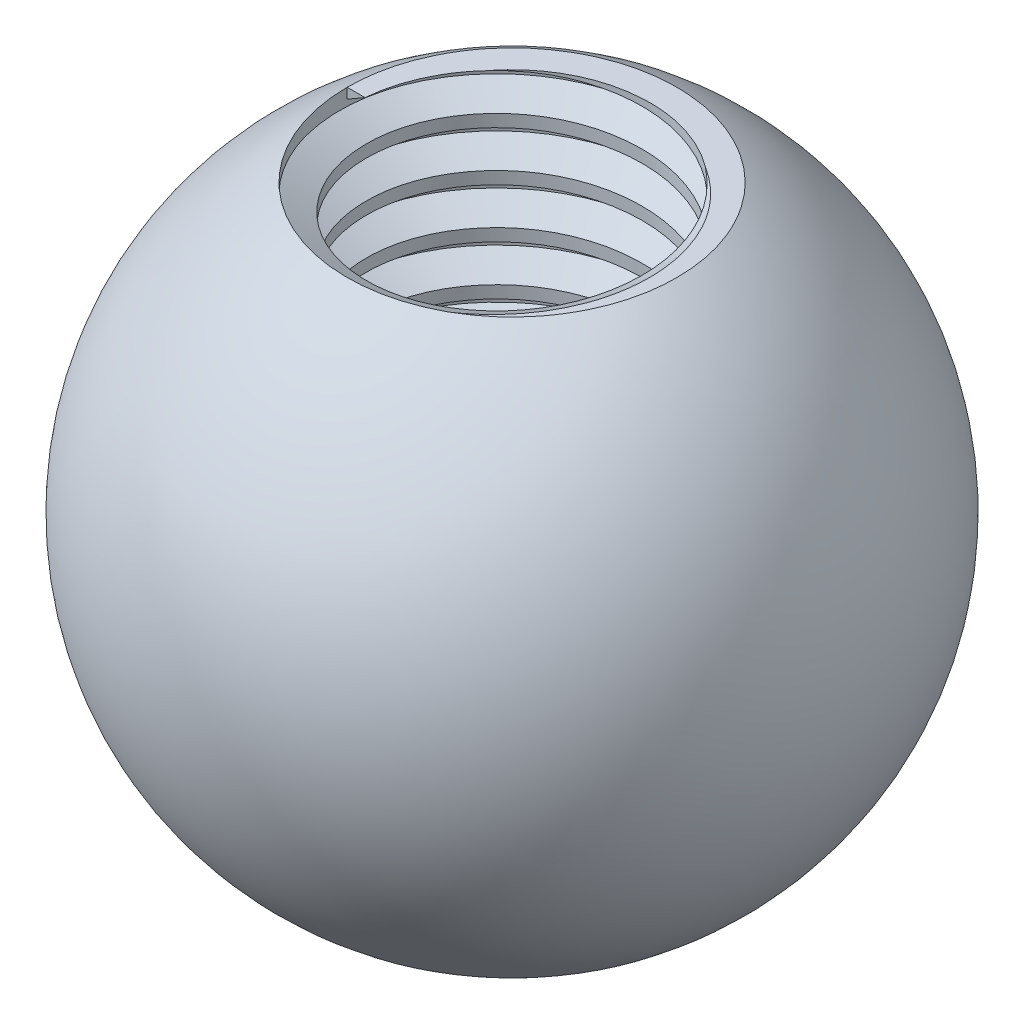
from build123d import *

# Parameters (mm, degrees)
SKETCH3_R              = 5
CUT_EXTRUDE1_DEPTH     = 10
THREAD1_PITCH          = 1.5
CUT_EXTRUDE2_START     = -6
CUT_EXTRUDE2_OUTLINE_W = 14
CUT_EXTRUDE2_OUTLINE_H = 2.339745962
CUT_EXTRUDE2_DEPTH     = 11.0000001


with BuildPart() as part:
    # Sketch2 → Revolve1 (revolve)
    with BuildSketch(Plane.XY):
        with BuildLine():
            Line((0, 10), (0, -10))
            ThreePointArc((0, -10), (10, 0), (0, 10))
        make_face()
    revolve(axis=Axis((0, 10, 0), (0, -1, 0)))

    # Sketch3 → Cut-Extrude1 (cut)
    with BuildSketch(Plane(origin=(0, 0, 0), x_dir=(1, 0, 0), z_dir=(0, 1, 0))):
        with Locations(Location((0, 0, 0), (0, 0, 90))):
            Circle(SKETCH3_R)
    extrude(amount=CUT_EXTRUDE1_DEPTH, mode=Mode.SUBTRACT)

    # Thread1: arcs per turn and ends read off the stored shape
    # Thread1: the profile of Thread Profile1 profile screwed along a right-hand helix through 7.333333 turns, 8 arcs to a turn; built about Z, then put on its axis
    thread1_z = Axis((0, 0, 0), (0, 0, 1))
    thread1_corners = [(5.0003, 0, -0.000173205), (5.0003, 0, 1.312673201), (4.188101188, 0, 0.843749998), (4.188101188, 0, 0.468749998)]
    with BuildLine(mode=Mode.PRIVATE) as thread1_profile:
        Line(thread1_corners[0], thread1_corners[1])
        Line(thread1_corners[1], thread1_corners[2])
        Line(thread1_corners[2], thread1_corners[3])
        Line(thread1_corners[3], thread1_corners[0])
    thread1_cap = Face(thread1_profile.wire())
    thread1_turn_angles = [0, 22.5, 45, 67.5, 90, 112.5, 135, 157.5, 180, 202.5, 225, 247.5, 270, 292.5, 315, 337.5, 360]
    thread1_turn_weights = [1, 0.9238795325112867, 1, 0.9238795325112867, 1, 0.9238795325112867, 1, 0.9238795325112867, 1, 0.9238795325112867, 1, 0.9238795325112867, 1, 0.9238795325112867, 1, 0.9238795325112867, 1]
    thread1_turn_rails = [Edge.make_bspline([Vector(p[0], p[1], 0).rotate(thread1_z, thread1_turn_angles[k]) / thread1_turn_weights[k] + Vector(0, 0, p[2] + THREAD1_PITCH * thread1_turn_angles[k] / 360) for k in range(17)], [0, 0, 0, 1, 1, 2, 2, 3, 3, 4, 4, 5, 5, 6, 6, 7, 7, 8, 8, 8], 2, thread1_turn_weights) for p in thread1_corners]
    thread1_turn_sides = [Face.make_surface_from_curves(thread1_turn_rails[p[0]], thread1_turn_rails[p[1]]) for p in [(0, 1), (1, 2), (2, 3), (3, 0)]]
    thread1_last_angles = [2520, 2542.5, 2565, 2587.5, 2610, 2625, 2640]
    thread1_last_weights = [1, 0.9238795325112867, 1, 0.9238795325112867, 1, 0.9659258262890693, 1]
    thread1_last_rails = [Edge.make_bspline([Vector(p[0], p[1], 0).rotate(thread1_z, thread1_last_angles[k]) / thread1_last_weights[k] + Vector(0, 0, p[2] + THREAD1_PITCH * thread1_last_angles[k] / 360) for k in range(7)], [0, 0, 0, 1, 1, 2, 2, 3, 3, 3], 2, thread1_last_weights) for p in thread1_corners]
    thread1_last_sides = [Face.make_surface_from_curves(thread1_last_rails[p[0]], thread1_last_rails[p[1]]) for p in [(0, 1), (1, 2), (2, 3), (3, 0)]]
    thread1 = Plane(origin=(0, 9.660254038, 0), x_dir=(-1, 0, 0), z_dir=(0, -1, 0)) * Solid(Shell([*[p.moved(Location((0, 0, THREAD1_PITCH * i))) for i in range(7) for p in thread1_turn_sides], *thread1_last_sides, thread1_cap, thread1_cap.rotate(thread1_z, 2640).moved(Location((0, 0, THREAD1_PITCH * 2640 / 360)))]))
    add(thread1)

    # Cut-Extrude2: read off the stored shape, not the designer's step
    # Cut-Extrude2 outline → Cut-Extrude2 (cut)
    with BuildSketch(Plane.XY.offset(CUT_EXTRUDE2_START)):
        with Locations((0, 9.830127019)):
            Rectangle(CUT_EXTRUDE2_OUTLINE_W, CUT_EXTRUDE2_OUTLINE_H)
    extrude(amount=CUT_EXTRUDE2_DEPTH, mode=Mode.SUBTRACT)


solid = part.part
